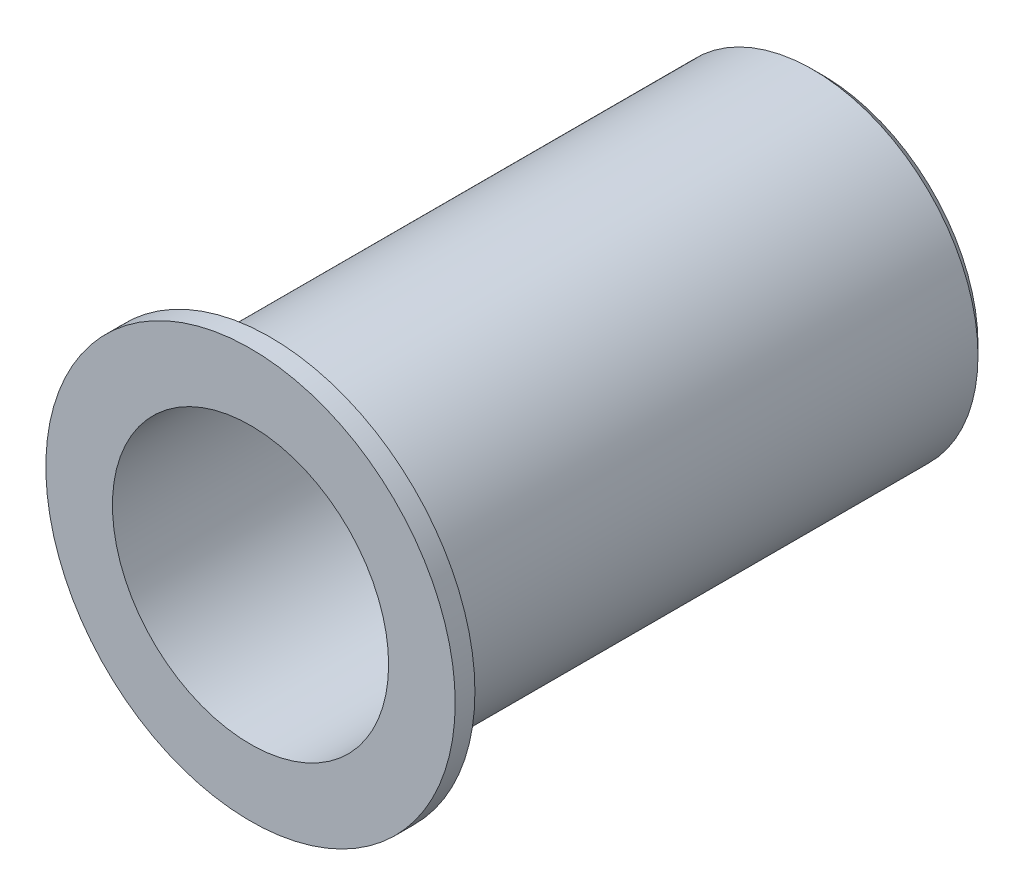
from build123d import *

# Parameters (mm, degrees)
SKETCH_1_R          = 8.375
EXTRUDE_1_DEPTH     = 28
SKETCH_2_R          = 7
CUT_EXTRUDE_3_DEPTH = 23
HOLE_WIZARD_M4_1_D  = 3.3
EXTRUDE_START       = 1
SKETCH_10_R         = 10.375
SKETCH_10_R_2       = 7
EXTRUDE_4_DEPTH     = 1
CHAMFER_1_SIZE      = 0.5


with BuildPart() as part:
    # 草图1 → 凸台-拉伸1 (new body)
    with BuildSketch(Plane.XY):
        Circle(SKETCH_1_R)
    extrude(amount=EXTRUDE_1_DEPTH)

    # 草图2 → 切除-拉伸3 (cut)
    with BuildSketch(Plane.XY.offset(28)):
        Circle(SKETCH_2_R)
    extrude(amount=-CUT_EXTRUDE_3_DEPTH, mode=Mode.SUBTRACT)

    # M4 螺纹孔1 (through all)
    with Locations(Plane(origin=(0, 0, 0), x_dir=(-1, 0, 0), z_dir=(0, 0, -1))):
        with Locations((0, 5), (0, 0), (-4.330127019, -2.5), (4.330127019, -2.5)):
            Hole(HOLE_WIZARD_M4_1_D / 2)

    # 草图10 → 凸台-拉伸4 (add)
    with BuildSketch(Plane.XY.offset(28).offset(EXTRUDE_START)):
        Circle(SKETCH_10_R)
        Circle(SKETCH_10_R_2, mode=Mode.SUBTRACT)
    extrude(amount=-EXTRUDE_4_DEPTH)

    # 倒角1
    chamfer_1_edges = [part.edges().sort_by_distance(p)[0] for p in [
        (-8.375, 0, 0),
    ]]
    chamfer(chamfer_1_edges, length=CHAMFER_1_SIZE)


solid = part.part
